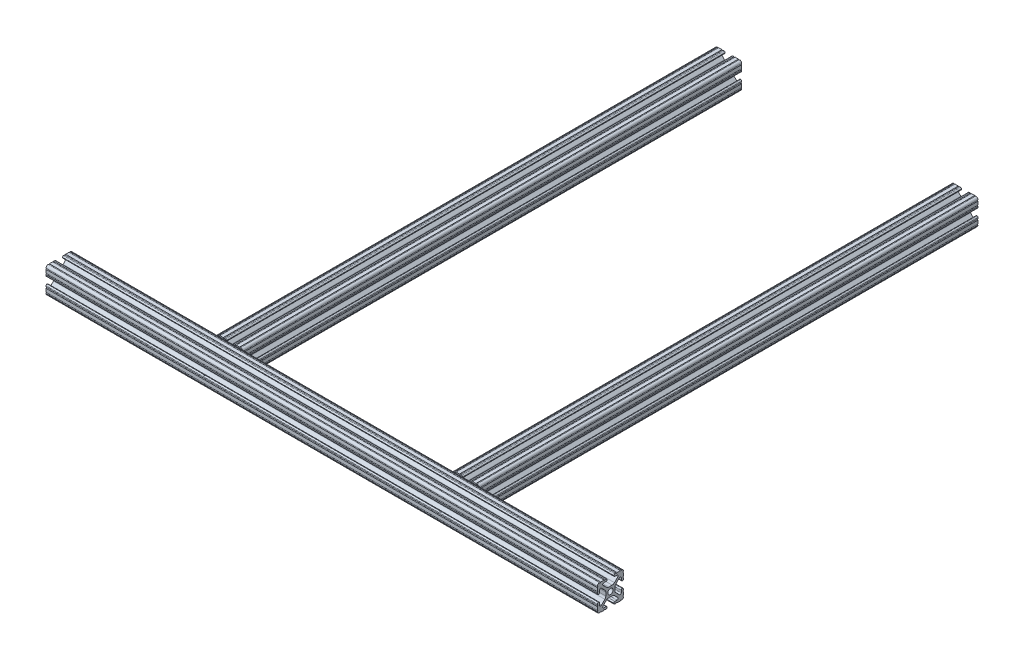
from build123d import *

# Parameters (mm, degrees)
F_8020_START                              = -495.3
F_8020_10_SERIES_1_X_1_X_25_1_OUTLINE_R   = 2.6035
F_8020_10_SERIES_1_X_1_X_25_1_DEPTH       = 482.6
F_8020_10_SERIES_1_X_1_X_25_1_2_OUTLINE_R = 2.6035
F_8020_10_SERIES_1_X_1_X_25_1_2_DEPTH     = 533.4
CUT_EXTRUDE1_REACH                        = 738.709
SKETCH2_R                                 = 3.3782


# Read off the part's stored shape, not the designer's step: 8020 10 series 1 X 1 X .25(1)
with BuildPart() as part:
    # 8020 10 series 1 X 1 X .25(1) outline → 8020 10 series 1 X 1 X .25(1) (new body)
    # profile 1 of 2: a face of its own
    with BuildSketch(Plane.XY.offset(F_8020_START)):
        with BuildLine():
            ThreePointArc((387.333126718, 12.7), (386.825126718, 12.192), (386.317126718, 12.7))
            Line((386.317126718, 12.7), (385.287512407, 12.7))
            ThreePointArc((385.287512407, 12.7), (384.54574862, 12.39275138), (384.2385, 11.650987593))
            Line((384.2385, 11.650987593), (384.2385, 11.539212407))
            ThreePointArc((384.2385, 11.539212407), (384.54574862, 10.79744862), (385.287512407, 10.4902))
            Line((385.287512407, 10.4902), (387.416408329, 10.4902))
            ThreePointArc((387.416408329, 10.4902), (388.41473083, 9.822813117), (388.179650497, 8.645192506))
            Line((388.179650497, 8.645192506), (384.952270251, 5.423690499))
            ThreePointArc((384.952270251, 5.423690499), (383.922936451, 4.736929036), (382.709253557, 4.4958))
            Line((382.709253557, 4.4958), (379.290746443, 4.4958))
            ThreePointArc((379.290746443, 4.4958), (378.077063549, 4.736929036), (377.047729749, 5.423690499))
            Line((377.047729749, 5.423690499), (373.820349503, 8.645192506))
            ThreePointArc((373.820349503, 8.645192506), (373.58526917, 9.822813117), (374.583591671, 10.4902))
            Line((374.583591671, 10.4902), (376.712487593, 10.4902))
            ThreePointArc((376.712487593, 10.4902), (377.454251379, 10.797448621), (377.7615, 11.539212407))
            Line((377.7615, 11.539212407), (377.7615, 11.650987593))
            ThreePointArc((377.7615, 11.650987593), (377.45425138, 12.39275138), (376.712487593, 12.7))
            Line((376.712487593, 12.7), (375.682873282, 12.7))
            ThreePointArc((375.682873282, 12.7), (375.174873282, 12.192), (374.666873282, 12.7))
            Line((374.666873282, 12.7), (371.449556882, 12.7))
            ThreePointArc((371.449556882, 12.7), (370.941633132, 12.192000006), (370.433556905, 12.699847501))
            ThreePointArc((370.433556905, 12.699847501), (368.917462238, 12.08250727), (368.300153018, 10.566399977))
            ThreePointArc((368.300153018, 10.566399977), (368.807999994, 10.058323491), (368.3, 9.5504))
            Line((368.3, 9.5504), (368.3, 6.3330836))
            ThreePointArc((368.3, 6.3330836), (368.808, 5.8250836), (368.3, 5.3170836))
            Line((368.3, 5.3170836), (368.3, 4.287469289))
            ThreePointArc((368.3, 4.287469289), (368.60724862, 3.545705502), (369.349012407, 3.238456882))
            Line((369.349012407, 3.238456882), (369.460787593, 3.238456882))
            ThreePointArc((369.460787593, 3.238456882), (370.202551379, 3.545705503), (370.5098, 4.287469289))
            Line((370.5098, 4.287469289), (370.5098, 6.402089023))
            ThreePointArc((370.5098, 6.402089023), (371.143494929, 7.351067942), (372.262868653, 7.129408934))
            Line((372.262868653, 7.129408934), (375.558994167, 3.840816462))
            ThreePointArc((375.558994167, 3.840816462), (376.249122033, 2.80988309), (376.4915, 1.593185507))
            Line((376.4915, 1.593185507), (376.4915, -1.593185507))
            ThreePointArc((376.4915, -1.593185507), (376.249122033, -2.80988309), (375.558994167, -3.840816462))
            Line((375.558994167, -3.840816462), (372.262868653, -7.129408934))
            ThreePointArc((372.262868653, -7.129408934), (371.143494929, -7.351067942), (370.5098, -6.402089023))
            Line((370.5098, -6.402089023), (370.5098, -4.287469289))
            ThreePointArc((370.5098, -4.287469289), (370.202551379, -3.545705503), (369.460787593, -3.238456882))
            Line((369.460787593, -3.238456882), (369.349012407, -3.238456882))
            ThreePointArc((369.349012407, -3.238456882), (368.60724862, -3.545705502), (368.3, -4.287469289))
            Line((368.3, -4.287469289), (368.3, -5.3170836))
            ThreePointArc((368.3, -5.3170836), (368.808, -5.8250836), (368.3, -6.3330836))
            Line((368.3, -6.3330836), (368.3, -9.5504))
            ThreePointArc((368.3, -9.5504), (368.807999994, -10.058323491), (368.300153018, -10.566399977))
            ThreePointArc((368.300153018, -10.566399977), (368.917462238, -12.08250727), (370.433556905, -12.699847501))
            ThreePointArc((370.433556905, -12.699847501), (370.941633132, -12.192000006), (371.449556882, -12.7))
            Line((371.449556882, -12.7), (374.666873282, -12.7))
            ThreePointArc((374.666873282, -12.7), (375.174873282, -12.192), (375.682873282, -12.7))
            Line((375.682873282, -12.7), (376.712487593, -12.7))
            ThreePointArc((376.712487593, -12.7), (377.454251379, -12.392751379), (377.7615, -11.650987593))
            Line((377.7615, -11.650987593), (377.7615, -11.539212407))
            ThreePointArc((377.7615, -11.539212407), (377.45425138, -10.79744862), (376.712487593, -10.4902))
            Line((376.712487593, -10.4902), (374.523211402, -10.4902))
            ThreePointArc((374.523211402, -10.4902), (373.567777615, -9.85140422), (373.792963992, -8.724370562))
            Line((373.792963992, -8.724370562), (377.101727434, -5.423169045))
            ThreePointArc((377.101727434, -5.423169045), (378.130879787, -4.736787962), (379.344221601, -4.4958))
            Line((379.344221601, -4.4958), (382.655778399, -4.4958))
            ThreePointArc((382.655778399, -4.4958), (383.869120213, -4.736787962), (384.898272566, -5.423169045))
            Line((384.898272566, -5.423169045), (388.207036008, -8.724370562))
            ThreePointArc((388.207036008, -8.724370562), (388.432222385, -9.85140422), (387.476788598, -10.4902))
            Line((387.476788598, -10.4902), (385.287512407, -10.4902))
            ThreePointArc((385.287512407, -10.4902), (384.54574862, -10.79744862), (384.2385, -11.539212407))
            Line((384.2385, -11.539212407), (384.2385, -11.650987593))
            ThreePointArc((384.2385, -11.650987593), (384.54574862, -12.39275138), (385.287512407, -12.7))
            Line((385.287512407, -12.7), (386.317126718, -12.7))
            ThreePointArc((386.317126718, -12.7), (386.825126718, -12.192), (387.333126718, -12.7))
            Line((387.333126718, -12.7), (390.550443118, -12.7))
            ThreePointArc((390.550443118, -12.7), (391.058366868, -12.192000006), (391.566443095, -12.699847501))
            ThreePointArc((391.566443095, -12.699847501), (393.082537762, -12.08250727), (393.699846982, -10.566399977))
            ThreePointArc((393.699846982, -10.566399977), (393.192000006, -10.058323491), (393.7, -9.5504))
            Line((393.7, -9.5504), (393.7, -6.3330836))
            ThreePointArc((393.7, -6.3330836), (393.192, -5.8250836), (393.7, -5.3170836))
            Line((393.7, -5.3170836), (393.7, -4.287469289))
            ThreePointArc((393.7, -4.287469289), (393.392751379, -3.545705503), (392.650987593, -3.238456882))
            Line((392.650987593, -3.238456882), (392.539212407, -3.238456882))
            ThreePointArc((392.539212407, -3.238456882), (391.79744862, -3.545705502), (391.4902, -4.287469289))
            Line((391.4902, -4.287469289), (391.4902, -6.402089023))
            ThreePointArc((391.4902, -6.402089023), (390.856505071, -7.351067942), (389.737131347, -7.129408934))
            Line((389.737131347, -7.129408934), (386.441005833, -3.840816462))
            ThreePointArc((386.441005833, -3.840816462), (385.750877967, -2.80988309), (385.5085, -1.593185507))
            Line((385.5085, -1.593185507), (385.5085, 2.9104418))
            Line((385.5085, 2.9104418), (389.737131347, 7.129408934))
            ThreePointArc((389.737131347, 7.129408934), (390.856505071, 7.351067942), (391.4902, 6.402089023))
            Line((391.4902, 6.402089023), (391.4902, 4.287469289))
            ThreePointArc((391.4902, 4.287469289), (391.79744862, 3.545705502), (392.539212407, 3.238456882))
            Line((392.539212407, 3.238456882), (392.650987593, 3.238456882))
            ThreePointArc((392.650987593, 3.238456882), (393.392751379, 3.545705503), (393.7, 4.287469289))
            Line((393.7, 4.287469289), (393.7, 5.3170836))
            ThreePointArc((393.7, 5.3170836), (393.192, 5.8250836), (393.7, 6.3330836))
            Line((393.7, 6.3330836), (393.7, 9.5504))
            ThreePointArc((393.7, 9.5504), (393.192000006, 10.058323491), (393.699846982, 10.566399977))
            ThreePointArc((393.699846982, 10.566399977), (393.082537762, 12.08250727), (391.566443095, 12.699847501))
            ThreePointArc((391.566443095, 12.699847501), (391.058366868, 12.192000006), (390.550443118, 12.7))
            Line((390.550443118, 12.7), (387.333126718, 12.7))
        make_face()
        with Locations((381, 0)):
            Circle(F_8020_10_SERIES_1_X_1_X_25_1_OUTLINE_R, mode=Mode.SUBTRACT)
    # profile 2 of 2: a face of its own
    with BuildSketch(Plane.XY.offset(F_8020_START)):
        with BuildLine():
            ThreePointArc((158.733126718, 12.7), (158.225126718, 12.192), (157.717126718, 12.7))
            Line((157.717126718, 12.7), (156.687512407, 12.7))
            ThreePointArc((156.687512407, 12.7), (155.94574862, 12.39275138), (155.6385, 11.650987593))
            Line((155.6385, 11.650987593), (155.6385, 11.539212407))
            ThreePointArc((155.6385, 11.539212407), (155.94574862, 10.79744862), (156.687512407, 10.4902))
            Line((156.687512407, 10.4902), (158.816408329, 10.4902))
            ThreePointArc((158.816408329, 10.4902), (159.81473083, 9.822813117), (159.579650497, 8.645192506))
            Line((159.579650497, 8.645192506), (156.352270251, 5.423690499))
            ThreePointArc((156.352270251, 5.423690499), (155.322936451, 4.736929036), (154.109253557, 4.4958))
            Line((154.109253557, 4.4958), (150.690746443, 4.4958))
            ThreePointArc((150.690746443, 4.4958), (149.477063549, 4.736929036), (148.447729749, 5.423690499))
            Line((148.447729749, 5.423690499), (145.220349503, 8.645192506))
            ThreePointArc((145.220349503, 8.645192506), (144.98526917, 9.822813117), (145.983591671, 10.4902))
            Line((145.983591671, 10.4902), (148.112487593, 10.4902))
            ThreePointArc((148.112487593, 10.4902), (148.854251379, 10.79744862), (149.1615, 11.539212407))
            Line((149.1615, 11.539212407), (149.1615, 11.650987593))
            ThreePointArc((149.1615, 11.650987593), (148.854251379, 12.392751379), (148.112487593, 12.7))
            Line((148.112487593, 12.7), (147.082873282, 12.7))
            ThreePointArc((147.082873282, 12.7), (146.574873282, 12.192), (146.066873282, 12.7))
            Line((146.066873282, 12.7), (142.849556882, 12.7))
            ThreePointArc((142.849556882, 12.7), (142.341633132, 12.192000006), (141.833556905, 12.699847501))
            ThreePointArc((141.833556905, 12.699847501), (140.317462238, 12.08250727), (139.700153018, 10.566399977))
            ThreePointArc((139.700153018, 10.566399977), (140.207999994, 10.058323491), (139.7, 9.5504))
            Line((139.7, 9.5504), (139.7, 6.3330836))
            ThreePointArc((139.7, 6.3330836), (140.208, 5.8250836), (139.7, 5.3170836))
            Line((139.7, 5.3170836), (139.7, 4.287469289))
            ThreePointArc((139.7, 4.287469289), (140.00724862, 3.545705502), (140.749012407, 3.238456882))
            Line((140.749012407, 3.238456882), (140.860787593, 3.238456882))
            ThreePointArc((140.860787593, 3.238456882), (141.602551379, 3.545705502), (141.9098, 4.287469289))
            Line((141.9098, 4.287469289), (141.9098, 6.402089023))
            ThreePointArc((141.9098, 6.402089023), (142.543494929, 7.351067942), (143.662868653, 7.129408934))
            Line((143.662868653, 7.129408934), (146.958994167, 3.840816462))
            ThreePointArc((146.958994167, 3.840816462), (147.649122033, 2.80988309), (147.8915, 1.593185507))
            Line((147.8915, 1.593185507), (147.8915, -1.593185507))
            ThreePointArc((147.8915, -1.593185507), (147.649122033, -2.80988309), (146.958994167, -3.840816462))
            Line((146.958994167, -3.840816462), (143.662868653, -7.129408934))
            ThreePointArc((143.662868653, -7.129408934), (142.543494929, -7.351067942), (141.9098, -6.402089023))
            Line((141.9098, -6.402089023), (141.9098, -4.287469289))
            ThreePointArc((141.9098, -4.287469289), (141.602551379, -3.545705502), (140.860787593, -3.238456882))
            Line((140.860787593, -3.238456882), (140.749012407, -3.238456882))
            ThreePointArc((140.749012407, -3.238456882), (140.00724862, -3.545705502), (139.7, -4.287469289))
            Line((139.7, -4.287469289), (139.7, -5.3170836))
            ThreePointArc((139.7, -5.3170836), (140.208, -5.8250836), (139.7, -6.3330836))
            Line((139.7, -6.3330836), (139.7, -9.5504))
            ThreePointArc((139.7, -9.5504), (140.207999994, -10.058323491), (139.700153018, -10.566399977))
            ThreePointArc((139.700153018, -10.566399977), (140.317462238, -12.08250727), (141.833556905, -12.699847501))
            ThreePointArc((141.833556905, -12.699847501), (142.341633132, -12.192000006), (142.849556882, -12.7))
            Line((142.849556882, -12.7), (146.066873282, -12.7))
            ThreePointArc((146.066873282, -12.7), (146.574873282, -12.192), (147.082873282, -12.7))
            Line((147.082873282, -12.7), (148.112487593, -12.7))
            ThreePointArc((148.112487593, -12.7), (148.854251379, -12.39275138), (149.1615, -11.650987593))
            Line((149.1615, -11.650987593), (149.1615, -11.539212407))
            ThreePointArc((149.1615, -11.539212407), (148.854251379, -10.797448621), (148.112487593, -10.4902))
            Line((148.112487593, -10.4902), (145.923211402, -10.4902))
            ThreePointArc((145.923211402, -10.4902), (144.967777615, -9.85140422), (145.192963992, -8.724370562))
            Line((145.192963992, -8.724370562), (148.501727434, -5.423169045))
            ThreePointArc((148.501727434, -5.423169045), (149.530879787, -4.736787962), (150.744221601, -4.4958))
            Line((150.744221601, -4.4958), (154.055778399, -4.4958))
            ThreePointArc((154.055778399, -4.4958), (155.269120213, -4.736787962), (156.298272566, -5.423169045))
            Line((156.298272566, -5.423169045), (159.607036008, -8.724370562))
            ThreePointArc((159.607036008, -8.724370562), (159.832222385, -9.85140422), (158.876788598, -10.4902))
            Line((158.876788598, -10.4902), (156.687512407, -10.4902))
            ThreePointArc((156.687512407, -10.4902), (155.94574862, -10.79744862), (155.6385, -11.539212407))
            Line((155.6385, -11.539212407), (155.6385, -11.650987593))
            ThreePointArc((155.6385, -11.650987593), (155.94574862, -12.39275138), (156.687512407, -12.7))
            Line((156.687512407, -12.7), (157.717126718, -12.7))
            ThreePointArc((157.717126718, -12.7), (158.225126718, -12.192), (158.733126718, -12.7))
            Line((158.733126718, -12.7), (161.950443118, -12.7))
            ThreePointArc((161.950443118, -12.7), (162.458366868, -12.192000006), (162.966443095, -12.699847501))
            ThreePointArc((162.966443095, -12.699847501), (164.482537762, -12.08250727), (165.099846982, -10.566399977))
            ThreePointArc((165.099846982, -10.566399977), (164.592000006, -10.058323491), (165.1, -9.5504))
            Line((165.1, -9.5504), (165.1, -6.3330836))
            ThreePointArc((165.1, -6.3330836), (164.592, -5.8250836), (165.1, -5.3170836))
            Line((165.1, -5.3170836), (165.1, -4.287469289))
            ThreePointArc((165.1, -4.287469289), (164.79275138, -3.545705502), (164.050987593, -3.238456882))
            Line((164.050987593, -3.238456882), (163.939212407, -3.238456882))
            ThreePointArc((163.939212407, -3.238456882), (163.19744862, -3.545705502), (162.8902, -4.287469289))
            Line((162.8902, -4.287469289), (162.8902, -6.402089023))
            ThreePointArc((162.8902, -6.402089023), (162.256505071, -7.351067942), (161.137131347, -7.129408934))
            Line((161.137131347, -7.129408934), (157.841005833, -3.840816462))
            ThreePointArc((157.841005833, -3.840816462), (157.150877967, -2.80988309), (156.9085, -1.593185507))
            Line((156.9085, -1.593185507), (156.9085, 2.9104418))
            Line((156.9085, 2.9104418), (161.137131347, 7.129408934))
            ThreePointArc((161.137131347, 7.129408934), (162.256505071, 7.351067942), (162.8902, 6.402089023))
            Line((162.8902, 6.402089023), (162.8902, 4.287469289))
            ThreePointArc((162.8902, 4.287469289), (163.19744862, 3.545705502), (163.939212407, 3.238456882))
            Line((163.939212407, 3.238456882), (164.050987593, 3.238456882))
            ThreePointArc((164.050987593, 3.238456882), (164.79275138, 3.545705502), (165.1, 4.287469289))
            Line((165.1, 4.287469289), (165.1, 5.3170836))
            ThreePointArc((165.1, 5.3170836), (164.592, 5.8250836), (165.1, 6.3330836))
            Line((165.1, 6.3330836), (165.1, 9.5504))
            ThreePointArc((165.1, 9.5504), (164.592000006, 10.058323491), (165.099846982, 10.566399977))
            ThreePointArc((165.099846982, 10.566399977), (164.482537762, 12.08250727), (162.966443095, 12.699847501))
            ThreePointArc((162.966443095, 12.699847501), (162.458366868, 12.192000006), (161.950443118, 12.7))
            Line((161.950443118, 12.7), (158.733126718, 12.7))
        make_face()
        with Locations((152.4, 0)):
            Circle(F_8020_10_SERIES_1_X_1_X_25_1_OUTLINE_R, mode=Mode.SUBTRACT)
    extrude(amount=F_8020_10_SERIES_1_X_1_X_25_1_DEPTH)


with BuildPart() as body_2:
    # 8020 10 series 1 X 1 X .25_1 2 outline → 8020 10 series 1 X 1 X .25_1 2 (new body)
    with BuildSketch(Plane.YZ):
        with BuildLine():
            Line((-12.7, -4.287512407), (-12.7, -5.317126718))
            ThreePointArc((-12.7, -5.317126718), (-12.192, -5.825126718), (-12.7, -6.333126718))
            Line((-12.7, -6.333126718), (-12.7, -9.550443118))
            ThreePointArc((-12.7, -9.550443118), (-12.192000006, -10.058366868), (-12.699847501, -10.566443095))
            ThreePointArc((-12.699847501, -10.566443095), (-12.08250727, -12.082537762), (-10.566399977, -12.699846982))
            ThreePointArc((-10.566399977, -12.699846982), (-10.058323491, -12.192000006), (-9.5504, -12.7))
            Line((-9.5504, -12.7), (-6.3330836, -12.7))
            ThreePointArc((-6.3330836, -12.7), (-5.8250836, -12.192), (-5.3170836, -12.7))
            Line((-5.3170836, -12.7), (-4.287469289, -12.7))
            ThreePointArc((-4.287469289, -12.7), (-3.545705502, -12.39275138), (-3.238456882, -11.650987593))
            Line((-3.238456882, -11.650987593), (-3.238456882, -11.539212407))
            ThreePointArc((-3.238456882, -11.539212407), (-3.545705502, -10.79744862), (-4.287469289, -10.4902))
            Line((-4.287469289, -10.4902), (-6.402089023, -10.4902))
            ThreePointArc((-6.402089023, -10.4902), (-7.351067942, -9.856505071), (-7.129408934, -8.737131347))
            Line((-7.129408934, -8.737131347), (-2.9104418, -4.5085))
            Line((-2.9104418, -4.5085), (1.593185507, -4.5085))
            ThreePointArc((1.593185507, -4.5085), (2.80988309, -4.750877967), (3.840816462, -5.441005833))
            Line((3.840816462, -5.441005833), (7.129408934, -8.737131347))
            ThreePointArc((7.129408934, -8.737131347), (7.351067942, -9.856505071), (6.402089023, -10.4902))
            Line((6.402089023, -10.4902), (4.287469289, -10.4902))
            ThreePointArc((4.287469289, -10.4902), (3.545705502, -10.79744862), (3.238456882, -11.539212407))
            Line((3.238456882, -11.539212407), (3.238456882, -11.650987593))
            ThreePointArc((3.238456882, -11.650987593), (3.545705502, -12.39275138), (4.287469289, -12.7))
            Line((4.287469289, -12.7), (5.3170836, -12.7))
            ThreePointArc((5.3170836, -12.7), (5.8250836, -12.192), (6.3330836, -12.7))
            Line((6.3330836, -12.7), (9.5504, -12.7))
            ThreePointArc((9.5504, -12.7), (10.058323491, -12.192000006), (10.566399977, -12.699846982))
            ThreePointArc((10.566399977, -12.699846982), (12.08250727, -12.082537762), (12.699847501, -10.566443095))
            ThreePointArc((12.699847501, -10.566443095), (12.192000006, -10.058366868), (12.7, -9.550443118))
            Line((12.7, -9.550443118), (12.7, -6.333126718))
            ThreePointArc((12.7, -6.333126718), (12.192, -5.825126718), (12.7, -5.317126718))
            Line((12.7, -5.317126718), (12.7, -4.287512407))
            ThreePointArc((12.7, -4.287512407), (12.39275138, -3.54574862), (11.650987593, -3.2385))
            Line((11.650987593, -3.2385), (11.539212407, -3.2385))
            ThreePointArc((11.539212407, -3.2385), (10.79744862, -3.54574862), (10.4902, -4.287512407))
            Line((10.4902, -4.287512407), (10.4902, -6.476788598))
            ThreePointArc((10.4902, -6.476788598), (9.85140422, -7.432222385), (8.724370562, -7.207036008))
            Line((8.724370562, -7.207036008), (5.423169045, -3.898272566))
            ThreePointArc((5.423169045, -3.898272566), (4.736787962, -2.869120213), (4.4958, -1.655778399))
            Line((4.4958, -1.655778399), (4.4958, 1.655778399))
            ThreePointArc((4.4958, 1.655778399), (4.736787962, 2.869120213), (5.423169045, 3.898272566))
            Line((5.423169045, 3.898272566), (8.724370562, 7.207036008))
            ThreePointArc((8.724370562, 7.207036008), (9.85140422, 7.432222385), (10.4902, 6.476788598))
            Line((10.4902, 6.476788598), (10.4902, 4.287512407))
            ThreePointArc((10.4902, 4.287512407), (10.79744862, 3.54574862), (11.539212407, 3.2385))
            Line((11.539212407, 3.2385), (11.650987593, 3.2385))
            ThreePointArc((11.650987593, 3.2385), (12.39275138, 3.54574862), (12.7, 4.287512407))
            Line((12.7, 4.287512407), (12.7, 5.317126718))
            ThreePointArc((12.7, 5.317126718), (12.192, 5.825126718), (12.7, 6.333126718))
            Line((12.7, 6.333126718), (12.7, 9.550443118))
            ThreePointArc((12.7, 9.550443118), (12.192000006, 10.058366868), (12.699847501, 10.566443095))
            ThreePointArc((12.699847501, 10.566443095), (12.08250727, 12.082537762), (10.566399977, 12.699846982))
            ThreePointArc((10.566399977, 12.699846982), (10.058323491, 12.192000006), (9.5504, 12.7))
            Line((9.5504, 12.7), (6.3330836, 12.7))
            ThreePointArc((6.3330836, 12.7), (5.8250836, 12.192), (5.3170836, 12.7))
            Line((5.3170836, 12.7), (4.287469289, 12.7))
            ThreePointArc((4.287469289, 12.7), (3.545705502, 12.39275138), (3.238456882, 11.650987593))
            Line((3.238456882, 11.650987593), (3.238456882, 11.539212407))
            ThreePointArc((3.238456882, 11.539212407), (3.545705502, 10.79744862), (4.287469289, 10.4902))
            Line((4.287469289, 10.4902), (6.402089023, 10.4902))
            ThreePointArc((6.402089023, 10.4902), (7.351067942, 9.856505071), (7.129408934, 8.737131347))
            Line((7.129408934, 8.737131347), (3.840816462, 5.441005833))
            ThreePointArc((3.840816462, 5.441005833), (2.80988309, 4.750877967), (1.593185507, 4.5085))
            Line((1.593185507, 4.5085), (-1.593185507, 4.5085))
            ThreePointArc((-1.593185507, 4.5085), (-2.80988309, 4.750877967), (-3.840816462, 5.441005833))
            Line((-3.840816462, 5.441005833), (-7.129408934, 8.737131347))
            ThreePointArc((-7.129408934, 8.737131347), (-7.351067942, 9.856505071), (-6.402089023, 10.4902))
            Line((-6.402089023, 10.4902), (-4.287469289, 10.4902))
            ThreePointArc((-4.287469289, 10.4902), (-3.545705502, 10.79744862), (-3.238456882, 11.539212407))
            Line((-3.238456882, 11.539212407), (-3.238456882, 11.650987593))
            ThreePointArc((-3.238456882, 11.650987593), (-3.545705502, 12.39275138), (-4.287469289, 12.7))
            Line((-4.287469289, 12.7), (-5.3170836, 12.7))
            ThreePointArc((-5.3170836, 12.7), (-5.8250836, 12.192), (-6.3330836, 12.7))
            Line((-6.3330836, 12.7), (-9.5504, 12.7))
            ThreePointArc((-9.5504, 12.7), (-10.058323491, 12.192000006), (-10.566399977, 12.699846982))
            ThreePointArc((-10.566399977, 12.699846982), (-12.08250727, 12.082537762), (-12.699847501, 10.566443095))
            ThreePointArc((-12.699847501, 10.566443095), (-12.192000006, 10.058366868), (-12.7, 9.550443118))
            Line((-12.7, 9.550443118), (-12.7, 6.333126718))
            ThreePointArc((-12.7, 6.333126718), (-12.192, 5.825126718), (-12.7, 5.317126718))
            Line((-12.7, 5.317126718), (-12.7, 4.287512407))
            ThreePointArc((-12.7, 4.287512407), (-12.39275138, 3.54574862), (-11.650987593, 3.2385))
            Line((-11.650987593, 3.2385), (-11.539212407, 3.2385))
            ThreePointArc((-11.539212407, 3.2385), (-10.79744862, 3.54574862), (-10.4902, 4.287512407))
            Line((-10.4902, 4.287512407), (-10.4902, 6.416408329))
            ThreePointArc((-10.4902, 6.416408329), (-9.822813117, 7.41473083), (-8.645192506, 7.179650497))
            Line((-8.645192506, 7.179650497), (-5.423690499, 3.952270251))
            ThreePointArc((-5.423690499, 3.952270251), (-4.736929036, 2.922936451), (-4.4958, 1.709253557))
            Line((-4.4958, 1.709253557), (-4.4958, -1.709253557))
            ThreePointArc((-4.4958, -1.709253557), (-4.736929036, -2.922936451), (-5.423690499, -3.952270251))
            Line((-5.423690499, -3.952270251), (-8.645192506, -7.179650497))
            ThreePointArc((-8.645192506, -7.179650497), (-9.822813117, -7.41473083), (-10.4902, -6.416408329))
            Line((-10.4902, -6.416408329), (-10.4902, -4.287512407))
            ThreePointArc((-10.4902, -4.287512407), (-10.79744862, -3.54574862), (-11.539212407, -3.2385))
            Line((-11.539212407, -3.2385), (-11.650987593, -3.2385))
            ThreePointArc((-11.650987593, -3.2385), (-12.39275138, -3.54574862), (-12.7, -4.287512407))
        make_face()
        Circle(F_8020_10_SERIES_1_X_1_X_25_1_2_OUTLINE_R, mode=Mode.SUBTRACT)
    extrude(amount=F_8020_10_SERIES_1_X_1_X_25_1_2_DEPTH)

    # Cut-Extrude1: up to this face of the body (flat: up to its plane)
    cut_extrude1_end = Plane(body_2.part.faces().sort_by_distance((266.7, -0.658628146, -4.5085))[0])
    # Sketch2 → Cut-Extrude1 (cut, up to the picked face)
    with BuildSketch(Plane.XY.offset(12.7), mode=Mode.PRIVATE) as cut_extrude1_sk1:
        with Locations(Location((152.4, 0, 0), (0, 0, 28.138713728))):
            Circle(SKETCH2_R)
    cut_extrude1_tool1 = split(extrude(cut_extrude1_sk1.sketch, amount=-CUT_EXTRUDE1_REACH, mode=Mode.PRIVATE), bisect_by=cut_extrude1_end, keep=Keep.BOTH, mode=Mode.PRIVATE)
    # Sketch2 → Cut-Extrude1 (cut, up to the picked face)
    with BuildSketch(Plane.XY.offset(12.7), mode=Mode.PRIVATE) as cut_extrude1_sk2:
        with Locations(Location((381, 0, 0), (0, 0, 28.138713728))):
            Circle(SKETCH2_R)
    cut_extrude1_tool2 = split(extrude(cut_extrude1_sk2.sketch, amount=-CUT_EXTRUDE1_REACH, mode=Mode.PRIVATE), bisect_by=cut_extrude1_end, keep=Keep.BOTH, mode=Mode.PRIVATE)
    add(cut_extrude1_tool1.solids().sort_by(Axis((152.4, 0, 12.7), (0, 0, -1)))[0], mode=Mode.SUBTRACT)
    add(cut_extrude1_tool2.solids().sort_by(Axis((381, 0, 12.7), (0, 0, -1)))[0], mode=Mode.SUBTRACT)


solid = Compound([part.part, body_2.part])
